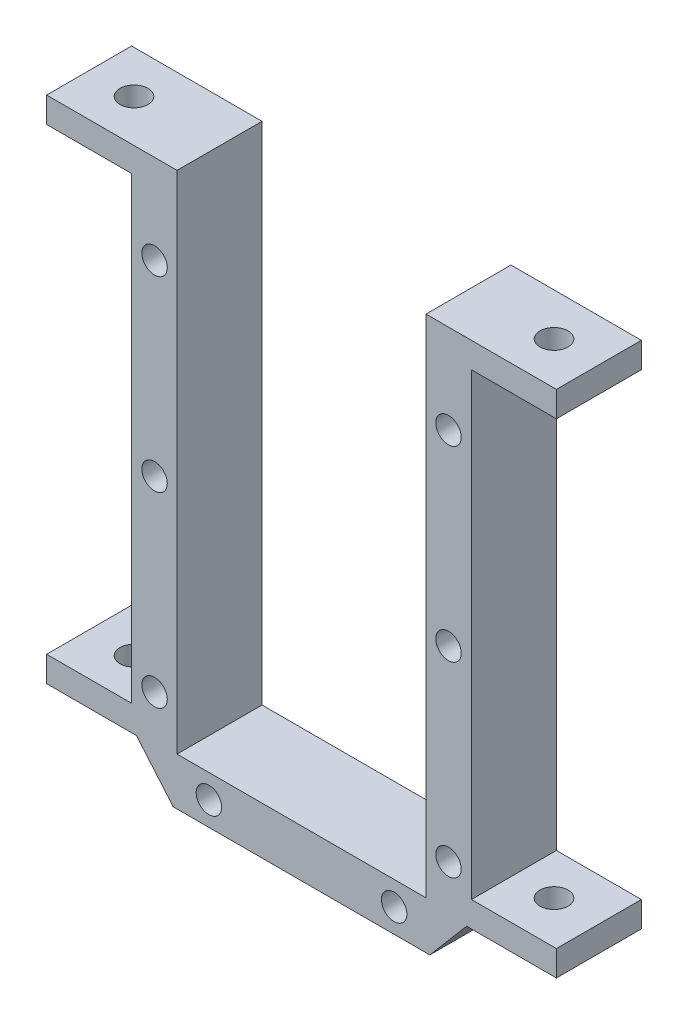
from build123d import *

# Parameters (mm, degrees)
SKETCH1_W           = 40
SKETCH1_H           = 65.1
BOSS_EXTRUDE1_DEPTH = 10
CUT_EXTRUDE1_DEPTH  = 10
SKETCH4_W           = 29.3
SKETCH4_H           = 59.5
CUT_EXTRUDE2_DEPTH  = 10
SKETCH5_R           = 1.5
CUT_EXTRUDE3_DEPTH  = 10
SKETCH7_W           = 10
SKETCH7_H           = 3
BOSS_EXTRUDE2_DEPTH = 10
SKETCH8_W           = 10
SKETCH8_H           = 3
BOSS_EXTRUDE3_DEPTH = 10
SKETCH9_R           = 1.65
CUT_EXTRUDE4_DEPTH  = 68.867591677
SKETCH10_R          = 1.65
CUT_EXTRUDE5_DEPTH  = 68.867591677


with BuildPart() as part:
    # Sketch1 → Boss-Extrude1 (new body)
    with BuildSketch(Plane.XY):
        with Locations((-0.1, 0)):
            Rectangle(SKETCH1_W, SKETCH1_H)
    extrude(amount=BOSS_EXTRUDE1_DEPTH)

    # Sketch2 → Cut-Extrude1 (cut)
    with BuildSketch(Plane.XY.offset(10)):
        Polygon((15, -32.55), (19.335, -27.45), (19.9, -27.45), (19.9, -32.55), align=None)
        Polygon((-20.1, -27.45), (-20.1, -32.55), (-15.2, -32.55), (-19.535, -27.45), align=None)
    extrude(amount=-CUT_EXTRUDE1_DEPTH, mode=Mode.SUBTRACT)

    # Sketch4 → Cut-Extrude2 (cut)
    with BuildSketch(Plane.XY.offset(10)):
        with Locations((-0.1, 2.8)):
            Rectangle(SKETCH4_W, SKETCH4_H)
    extrude(amount=-CUT_EXTRUDE2_DEPTH, mode=Mode.SUBTRACT)

    # Sketch5 → Cut-Extrude3 (cut)
    with BuildSketch(Plane.XY.offset(10)):
        with Locations((-17.4, 22.05)):
            Circle(SKETCH5_R)
        with Locations((-17.4, 0.05)):
            Circle(SKETCH5_R)
        with Locations((-17.4, -21.95)):
            Circle(SKETCH5_R)
        with Locations((-11, -29.75)):
            Circle(SKETCH5_R)
        with Locations((10.8, -29.75)):
            Circle(SKETCH5_R)
        with Locations((17.2, -21.95)):
            Circle(SKETCH5_R)
        with Locations((17.2, 0.05)):
            Circle(SKETCH5_R)
        with Locations((17.2, 22.05)):
            Circle(SKETCH5_R)
    extrude(amount=-CUT_EXTRUDE3_DEPTH, mode=Mode.SUBTRACT)

    # Sketch7 → Boss-Extrude2 (add)
    with BuildSketch(Plane(origin=(19.9, 0, 0), x_dir=(0, 0, -1), z_dir=(1, 0, 0))):
        with Locations((-5, 31.05)):
            Rectangle(SKETCH7_W, SKETCH7_H)
        with Locations((-5, -25.95)):
            Rectangle(SKETCH7_W, SKETCH7_H)
    extrude(amount=BOSS_EXTRUDE2_DEPTH)

    # Sketch8 → Boss-Extrude3 (add)
    with BuildSketch(Plane.ZY.offset(20.1)):
        with Locations((5, 31.05)):
            Rectangle(SKETCH8_W, SKETCH8_H)
        with Locations((5, -25.95)):
            Rectangle(SKETCH8_W, SKETCH8_H)
    extrude(amount=BOSS_EXTRUDE3_DEPTH)

    # Sketch9 → Cut-Extrude4 (cut, through all)
    with BuildSketch(Plane(origin=(0, -27.45, 0), x_dir=(-1, 0, 0), z_dir=(0, -1, 0))):
        with Locations((24.8175, -5)):
            Circle(SKETCH9_R)
    extrude(amount=-CUT_EXTRUDE4_DEPTH, mode=Mode.SUBTRACT)

    # Sketch10 → Cut-Extrude5 (cut, through all)
    with BuildSketch(Plane(origin=(0, -27.45, 0), x_dir=(-1, 0, 0), z_dir=(0, -1, 0))):
        with Locations((-24.6175, -5)):
            Circle(SKETCH10_R)
    extrude(amount=-CUT_EXTRUDE5_DEPTH, mode=Mode.SUBTRACT)


solid = part.part
